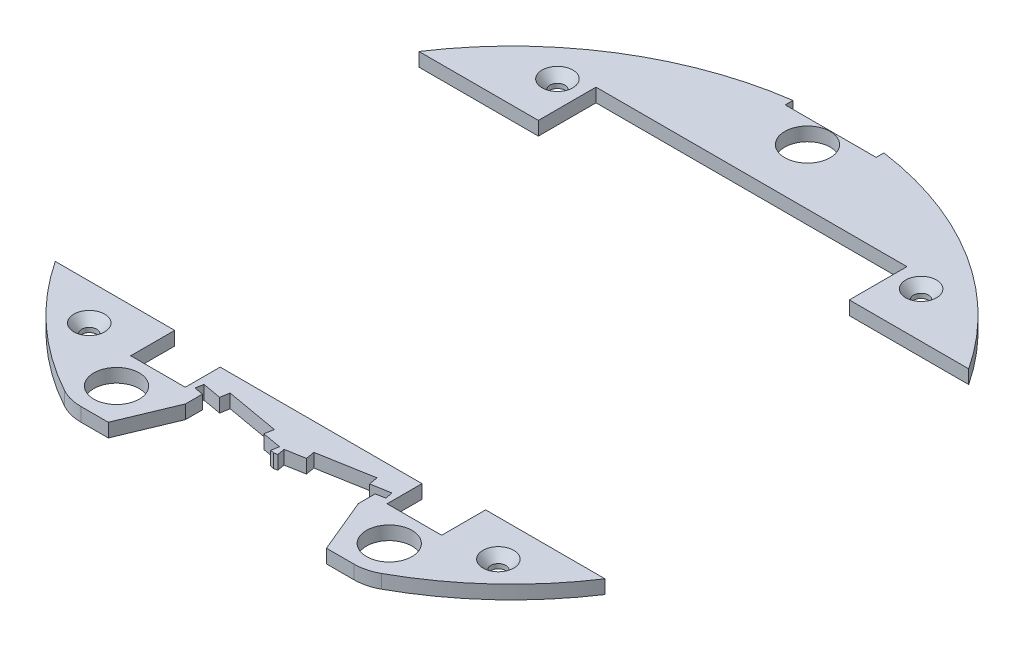
from build123d import *
from OCP.BRepFilletAPI import BRepFilletAPI_MakeChamfer

# Parameters (mm, degrees)
BOSS_EXTRUDE1_DEPTH = 3
CUT_EXTRUDE1_DEPTH  = 103.574363269
SKETCH3_W           = 38.3
SKETCH3_H           = 80
CUT_EXTRUDE2_DEPTH  = 103.574363269
CUT_EXTRUDE3_DEPTH  = 95.453692358
CUT_EXTRUDE4_DEPTH  = 95.453692358
SKETCH6_W           = 68.4
SKETCH6_H           = 3
CUT_EXTRUDE5_DEPTH  = 95.453692358
SKETCH7_R           = 5
CUT_EXTRUDE6_DEPTH  = 95.453692358
SKETCH11_R          = 5
CUT_EXTRUDE10_DEPTH = 95.453692358
CUT_EXTRUDE11_DEPTH = 95.453692358
SKETCH14_R          = 1.65
CUT_EXTRUDE12_DEPTH = 95.453692358
SKETCH15_W          = 20
SKETCH15_H          = 1.7
CUT_EXTRUDE13_DEPTH = 10
CHAMFER1_SIZE       = 2
CHAMFER1_SIZE2      = 1.738573476
CHAMFER2_SIZE       = 2
CHAMFER2_SIZE2      = 1.738573476


with BuildPart() as part:
    # Sketch1 → Boss-Extrude1 (new body)
    with BuildSketch(Plane(origin=(0, 0, 0), x_dir=(1, 0, 0), z_dir=(0, 1, 0))):
        with BuildLine():
            Line((-30.029977361, -64.812867647), (30.029977361, -64.812867647))
            ThreePointArc((30.029977361, -64.812867647), (32.509837414, -64.500503794), (34.834773739, -63.582926471))
            ThreePointArc((34.834773739, -63.582926471), (0, 72.5), (-34.834773739, -63.582926471))
            ThreePointArc((-34.834773739, -63.582926471), (-32.509837414, -64.500503794), (-30.029977361, -64.812867647))
        make_face()
    extrude(amount=BOSS_EXTRUDE1_DEPTH)

    # Sketch2 → Cut-Extrude1 (cut, through all)
    with BuildSketch(Plane(origin=(0, 3, 0), x_dir=(1, 0, 0), z_dir=(0, 1, 0))):
        Polygon((22.2, -42), (22.2, -49.675685802), (34.2, -49.675685802), (34.2, 49.675685802), (22.2, 49.675685802), (22.2, 45.5), (-22.2, 45.5), (-22.2, 49.675685802), (-34.2, 49.675685802), (-34.2, -49.675685802), (-22.2, -49.675685802), (-22.2, -42), align=None)
    extrude(amount=-CUT_EXTRUDE1_DEPTH, mode=Mode.SUBTRACT)

    # Sketch3 → Cut-Extrude2 (cut, through all)
    with BuildSketch(Plane(origin=(0, 3, 0), x_dir=(1, 0, 0), z_dir=(0, 1, 0))):
        with Locations((-53.35, 0)):
            Rectangle(SKETCH3_W, SKETCH3_H)
        with Locations((53.35, 0)):
            Rectangle(SKETCH3_W, SKETCH3_H)
    extrude(amount=-CUT_EXTRUDE2_DEPTH, mode=Mode.SUBTRACT)


with BuildPart() as cut_extrude2_piece_1:
    # of the separate pieces the step leaves, piece 1, a body of its own (cut_extrude2_pieces)
    add(part.part.solids().sort_by_distance((60.466933112, 0, -40))[0])

    # Sketch6 → Cut-Extrude5 (cut, through all)
    with BuildSketch(Plane(origin=(0, 3, 0), x_dir=(1, 0, 0), z_dir=(0, 1, 0))):
        with Locations((0, 51.175685802)):
            Rectangle(SKETCH6_W, SKETCH6_H)
    extrude(amount=-CUT_EXTRUDE5_DEPTH, mode=Mode.SUBTRACT)


with BuildPart() as cut_extrude2_piece_2:
    # of the separate pieces the step leaves, piece 2, a body of its own (cut_extrude2_pieces)
    add(part.part.solids().sort_by_distance((-34.834773739, 0, 63.582926471))[0])

    # Sketch4 → Cut-Extrude3 (cut, through all)
    with BuildSketch(Plane(origin=(0, 3, 0), x_dir=(1, 0, 0), z_dir=(0, 1, 0))):
        Polygon((-20.983760839, -48.753080005), (-0.795201902, -52.312867647), (-0.5, -50.638694467), (-20.688558937, -47.078906825), align=None)
        Polygon((20.983760839, -48.753080005), (20.688558937, -47.078906825), (0.5, -50.638694467), (0.795201902, -52.312867647), align=None)
    extrude(amount=-CUT_EXTRUDE3_DEPTH, mode=Mode.SUBTRACT)

    # Sketch5 → Cut-Extrude4 (cut, through all)
    with BuildSketch(Plane(origin=(0, 3, 0), x_dir=(1, 0, 0), z_dir=(0, 1, 0))):
        Polygon((-19, -64.812867647), (-19, -49.102870564), (0, -52.453083197), (19, -49.102870564), (19, -64.812867647), align=None)
        Polygon((16.503125986, -47.81691158), (4.68543295, -49.900689712), (4.338136595, -47.931074206), (16.155829631, -45.847296074), align=None)
        Polygon((-16.155829631, -45.847296074), (-4.338136595, -47.931074206), (-4.68543295, -49.900689712), (-16.503125986, -47.81691158), align=None)
    extrude(amount=-CUT_EXTRUDE4_DEPTH, mode=Mode.SUBTRACT)

    # Sketch7 → Cut-Extrude6 (cut, through all)
    with BuildSketch(Plane(origin=(0, 3, 0), x_dir=(1, 0, 0), z_dir=(0, 1, 0))):
        with Locations((-30, -57)):
            Circle(SKETCH7_R)
        with Locations((30, -57)):
            Circle(SKETCH7_R)
    extrude(amount=-CUT_EXTRUDE6_DEPTH, mode=Mode.SUBTRACT)

    # Sketch13 → Cut-Extrude11 (cut, through all)
    with BuildSketch(Plane(origin=(0, 3, 0), x_dir=(1, 0, 0), z_dir=(0, 1, 0))):
        Polygon((19, -52.812867647), (24, -64.812867647), (19, -64.812867647), align=None)
        Polygon((-19, -64.812867647), (-19, -52.812867647), (-24, -64.812867647), align=None)
    extrude(amount=-CUT_EXTRUDE11_DEPTH, mode=Mode.SUBTRACT)


with BuildPart() as cut_extrude5_kept_piece:
    # of the separate pieces the step leaves, the one the design keeps (cut_extrude5_pieces_kept)
    add(cut_extrude2_piece_1.part.solids().sort_by_distance((60.466933112, 0, -40))[0])

    # Sketch11 → Cut-Extrude10 (cut, through all)
    with BuildSketch(Plane(origin=(0, 3, 0), x_dir=(1, 0, 0), z_dir=(0, 1, 0))):
        with Locations((0, 65)):
            Circle(SKETCH11_R)
    extrude(amount=-CUT_EXTRUDE10_DEPTH, mode=Mode.SUBTRACT)


with BuildPart() as cut_extrude12_tool:
    # Sketch14 → Cut-Extrude12 (new, through all)
    with BuildSketch(Plane(origin=(0, 3, 0), x_dir=(1, 0, 0), z_dir=(0, 1, 0))):
        with Locations((45, -48)):
            Circle(SKETCH14_R)
        with Locations((-45, -48)):
            Circle(SKETCH14_R)
        with Locations((40, 50)):
            Circle(SKETCH14_R)
        with Locations((-40, 50)):
            Circle(SKETCH14_R)
    extrude(amount=-CUT_EXTRUDE12_DEPTH)


with BuildPart() as cut_extrude2_piece_2_1:
    add(cut_extrude2_piece_2.part)

    # Cut-Extrude12: cut by cut_extrude12_tool
    add(cut_extrude12_tool.part, mode=Mode.SUBTRACT)

    # Chamfer1: one chamfer whose edges measure the first distance from different faces: ONE call of the kernel's chamfer builder (chamfer() names one face for all edges)
    chamfer1_edges_1 = [cut_extrude2_piece_2_1.edges().sort_by_distance(p)[0] for p in [
        (-46.65, 3, 48),
    ]]
    chamfer1_side_1 = [cut_extrude2_piece_2_1.faces().sort_by_distance(p)[0] for p in [
        (-46.65, 1.5, 48),
    ]]
    chamfer1_edges_2 = [cut_extrude2_piece_2_1.edges().sort_by_distance(p)[0] for p in [
        (43.35, 3, 48),
    ]]
    chamfer1_side_2 = [cut_extrude2_piece_2_1.faces().sort_by_distance(p)[0] for p in [
        (43.35, 1.5, 48),
    ]]
    chamfer1 = BRepFilletAPI_MakeChamfer(cut_extrude2_piece_2_1.part.solid().wrapped)
    for e in chamfer1_edges_1:
        chamfer1.Add(CHAMFER1_SIZE, CHAMFER1_SIZE2, e.wrapped, chamfer1_side_1[0].wrapped)  # the first distance lies on this face
    for e in chamfer1_edges_2:
        chamfer1.Add(CHAMFER1_SIZE, CHAMFER1_SIZE2, e.wrapped, chamfer1_side_2[0].wrapped)  # the first distance lies on this face
    add(Compound.cast(chamfer1.Shape()), mode=Mode.REPLACE)


with BuildPart() as cut_extrude5_kept_piece_1:
    add(cut_extrude5_kept_piece.part)

    # Cut-Extrude12: cut by cut_extrude12_tool
    add(cut_extrude12_tool.part, mode=Mode.SUBTRACT)

    # Sketch15 → Cut-Extrude13 (cut)
    with BuildSketch(Plane(origin=(0, 3, 0), x_dir=(1, 0, 0), z_dir=(0, 1, 0))):
        with Locations((0, 70.957033082)):
            Rectangle(SKETCH15_W, SKETCH15_H)
    extrude(amount=-CUT_EXTRUDE13_DEPTH, mode=Mode.SUBTRACT)


with BuildPart() as body_3:
    # of the pieces the cut leaves, the one that is kept (cut_extrude13_keep)
    add(cut_extrude5_kept_piece_1.part.solids().sort_by_distance((60.466933112, 0, -40))[0])

    # Chamfer2: one chamfer whose edges measure the first distance from different faces: ONE call of the kernel's chamfer builder (chamfer() names one face for all edges)
    chamfer2_edges_1 = [body_3.edges().sort_by_distance(p)[0] for p in [
        (-41.65, 3, -50),
    ]]
    chamfer2_side_1 = [body_3.faces().sort_by_distance(p)[0] for p in [
        (-41.65, 1.5, -50),
    ]]
    chamfer2_edges_2 = [body_3.edges().sort_by_distance(p)[0] for p in [
        (38.35, 3, -50),
    ]]
    chamfer2_side_2 = [body_3.faces().sort_by_distance(p)[0] for p in [
        (38.35, 1.5, -50),
    ]]
    chamfer2 = BRepFilletAPI_MakeChamfer(body_3.part.solid().wrapped)
    for e in chamfer2_edges_1:
        chamfer2.Add(CHAMFER2_SIZE, CHAMFER2_SIZE2, e.wrapped, chamfer2_side_1[0].wrapped)  # the first distance lies on this face
    for e in chamfer2_edges_2:
        chamfer2.Add(CHAMFER2_SIZE, CHAMFER2_SIZE2, e.wrapped, chamfer2_side_2[0].wrapped)  # the first distance lies on this face
    add(Compound.cast(chamfer2.Shape()), mode=Mode.REPLACE)


solid = Compound([cut_extrude2_piece_2_1.part, body_3.part])
